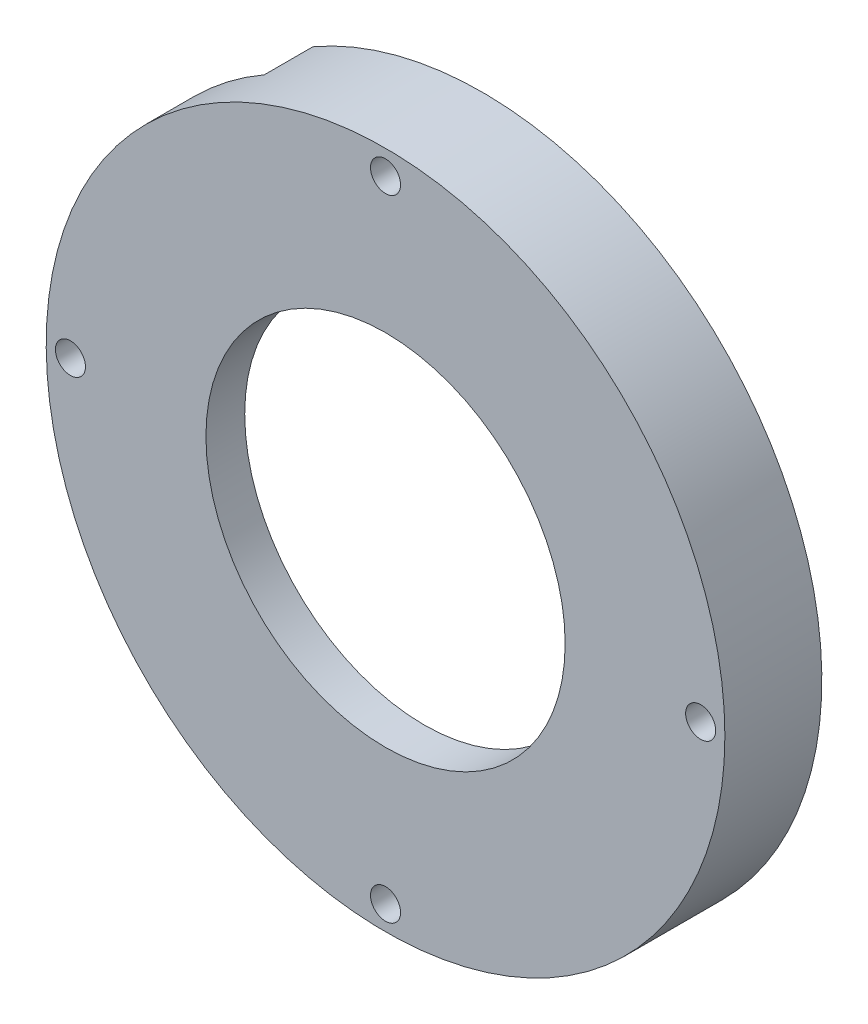
from build123d import *

# Parameters (mm, degrees)
EXTRUDE_1_OUTLINE_R   = 35
EXTRUDE_1_OUTLINE_R_2 = 1.55
EXTRUDE_1_OUTLINE_R_3 = 30.05
EXTRUDE_1_DEPTH       = 10
SKETCH_2_R            = 33.525
SKETCH_2_R_2          = 18.525
EXTRUDE_1_2_DEPTH     = 4
SKETCH_3_R            = 1.55
CUT_EXTRUDE_1_DEPTH   = 51.497524692
CUT_EXTRUDE_2_DEPTH   = 5


# Read off the part's stored shape, not the designer's step: 凸台-拉伸1
with BuildPart() as part:
    # Extrude 1 outline → Extrude 1 (new body)
    with BuildSketch(Plane.XY):
        Circle(EXTRUDE_1_OUTLINE_R)
        with Locations((0, -32.5)):
            Circle(EXTRUDE_1_OUTLINE_R_2, mode=Mode.SUBTRACT)
        with Locations((-32.5, 0)):
            Circle(EXTRUDE_1_OUTLINE_R_2, mode=Mode.SUBTRACT)
        Circle(EXTRUDE_1_OUTLINE_R_3, mode=Mode.SUBTRACT)
        with Locations((32.5, 0)):
            Circle(EXTRUDE_1_OUTLINE_R_2, mode=Mode.SUBTRACT)
        with Locations((0, 32.5)):
            Circle(EXTRUDE_1_OUTLINE_R_2, mode=Mode.SUBTRACT)
    extrude(amount=EXTRUDE_1_DEPTH)

    # 草图2 → Extrude 1 2 (add)
    with BuildSketch(Plane.XY.offset(10)):
        Circle(SKETCH_2_R)
        Circle(SKETCH_2_R_2, mode=Mode.SUBTRACT)
    extrude(amount=-EXTRUDE_1_2_DEPTH)

    # 草图3 → 切除-拉伸1 (cut, through all)
    with BuildSketch(Plane(origin=(0, 0, 0), x_dir=(-1, 0, 0), z_dir=(0, 0, -1))):
        with Locations(Location((32.5, 0, 0), (0, 0, 180))):
            Circle(SKETCH_3_R)
        with Locations(Location((0, -32.5, 0), (0, 0, 180))):
            Circle(SKETCH_3_R)
        with Locations(Location((-32.5, 0, 0), (0, 0, 180))):
            Circle(SKETCH_3_R)
        with Locations(Location((0, 32.5, 0), (0, 0, 180))):
            Circle(SKETCH_3_R)
    extrude(amount=-CUT_EXTRUDE_1_DEPTH, mode=Mode.SUBTRACT)

    # 草图7 → 切除-拉伸2 (cut)
    with BuildSketch(Plane(origin=(0, 0, 0), x_dir=(-1, 0, 0), z_dir=(0, 0, -1))):
        with BuildLine():
            Line((15.025, 26.024063384), (17.5, 30.310889132))
            ThreePointArc((17.5, 30.310889132), (24.748737342, 24.748737342), (30.310889132, 17.5))
            Line((30.310889132, 17.5), (26.024063384, 15.025))
            ThreePointArc((26.024063384, 15.025), (21.248558775, 21.248558775), (15.025, 26.024063384))
        make_face()
    extrude(amount=-CUT_EXTRUDE_2_DEPTH, mode=Mode.SUBTRACT)


solid = part.part
